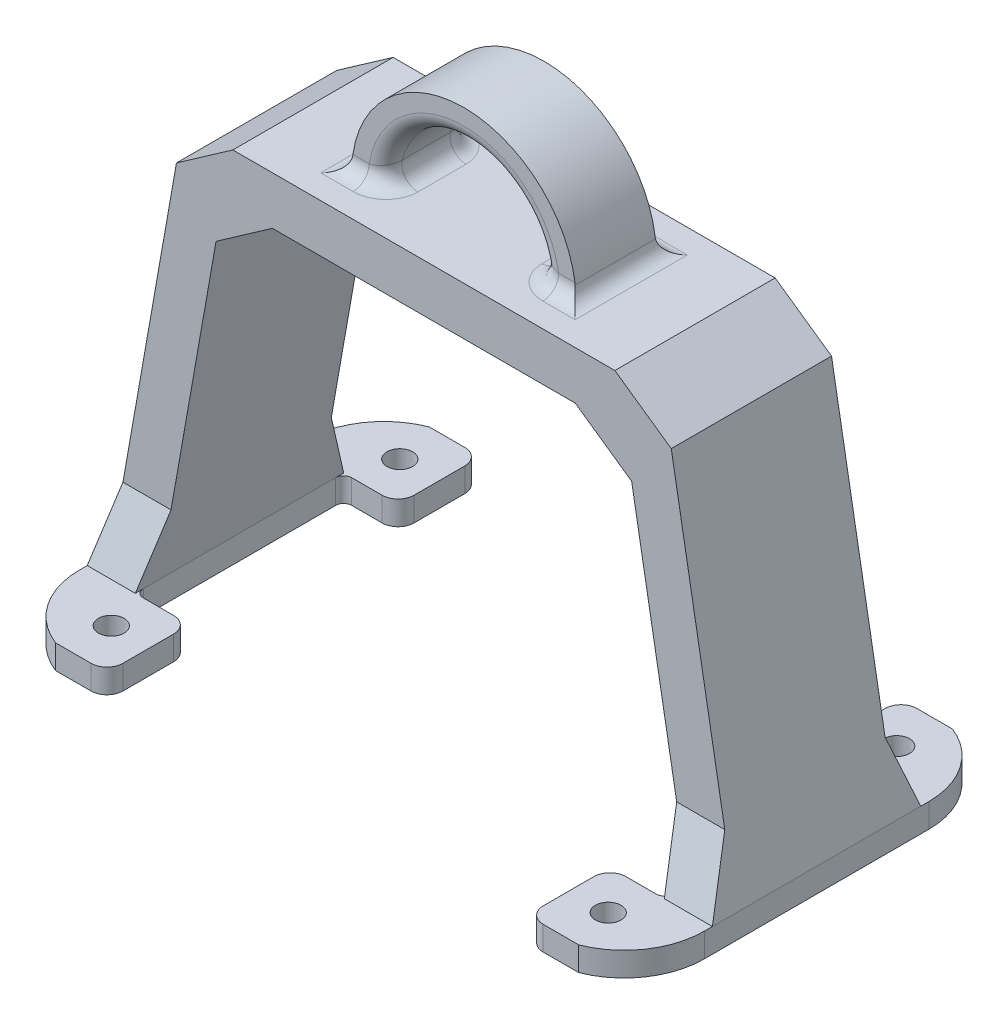
from build123d import *
from OCP.BRepFilletAPI import BRepFilletAPI_MakeChamfer

# Parameters (mm, degrees)
SKETCH1_R                = 1.6
SKETCH1_R_2              = 1.599999999999995
BOSS_EXTRUDE1_DEPTH      = 3
BOSS_EXTRUDE2_DEPTH      = 10
BOSS_EXTRUDE2_DEPTH_BACK = 10
CHAMFER1_SIZE            = 3
CHAMFER1_SIZE_2          = 8.242432258
CHAMFER2_SIZE            = 5
CHAMFER2_SIZE2           = 6.165654700734795
CHAMFER2_SIZE2_2         = 6.165654700734792
FILLET1_R                = 1
FILLET2_R                = 2
BOSS_EXTRUDE3_DEPTH      = 5
BOSS_EXTRUDE3_DEPTH_BACK = 5
FILLET3_R                = 2


with BuildPart() as part:
    # Sketch1 → Boss-Extrude1 (new body)
    with BuildSketch(Plane(origin=(0, 0, 0), x_dir=(1, 0, 0), z_dir=(0, 1, 0))):
        with BuildLine():
            Line((6.421175820560995, -1.9507906118067657), (0, -1.9507906118067657))
            Line((0, -1.9507906118067657), (0, 8.370717643509872))
            Line((0, 8.370717643509872), (6.784812184197089, 8.370717643509872))
            Line((6.784812184197089, 8.370717643509872), (6.784812184197089, 34.370717643510055))
            Line((6.784812184197089, 34.370717643510055), (0, 34.370717643510055))
            Line((0, 34.370717643510055), (0, 44.69222589882669))
            Line((0, 44.69222589882669), (6.421175820560995, 44.69222589882669))
            ThreePointArc((6.421175820560995, 44.69222589882669), (11.042040422644941, 41.01757685976807), (12.78481218419652, 35.37681611159011))
            Line((12.78481218419652, 35.37681611159011), (12.784812184196529, 7.364619175428122))
            ThreePointArc((12.784812184196529, 7.364619175428122), (11.042040422644465, 1.7238584272511508), (6.421175820560995, -1.9507906118067657))
        make_face()
        with Locations(Location((4.7848121841973095, 3.370717643509865, 0), (0, 0, 270))):
            Circle(SKETCH1_R, mode=Mode.SUBTRACT)
        with Locations(Location((4.7848121841973095, 39.37071764350986, 0), (0, 0, 270))):
            Circle(SKETCH1_R_2, mode=Mode.SUBTRACT)
    extrude(amount=BOSS_EXTRUDE1_DEPTH)

    # Sketch2 → Boss-Extrude2 (add, two sides: drawn at the far end of the back side and taken through both)
    with BuildSketch(Plane.XY.offset(-21.370717643509963).offset(-BOSS_EXTRUDE2_DEPTH_BACK)):
        Polygon((12.784812184196529, 3), (4.841459537267648, 48), (3.782345851010469, 54.00000000000001), (-26.217654148989528, 54), (-26.217654148989528, 48), (-1.158540462732349, 48), (6.784812184196529, 3), align=None)
    extrude(amount=BOSS_EXTRUDE2_DEPTH + BOSS_EXTRUDE2_DEPTH_BACK)

    # Chamfer1
    # the kernel refuses this chamfer: 8.242432258, 3 mm, written as the material it adds along each edge
    with BuildSketch(Plane(origin=(-14.597662163855837, 3, -31.370717643509963), x_dir=(0, -0.09904090225205073, -0.9950833631817486), z_dir=(1, 0, 0))) as chamfer1_piece_1_section:
        Polygon((CHAMFER1_SIZE * 0.995083363182, CHAMFER1_SIZE * 0.0990409022521), (-CHAMFER1_SIZE_2 * 0.0990409022564, CHAMFER1_SIZE_2 * 0.995083363226), (0, 0), align=None)
    chamfer1_piece_1 = extrude(amount=27.382474348052366, mode=Mode.PRIVATE)
    chamfer1_piece_1 = split(chamfer1_piece_1, bisect_by=Plane(origin=(6.784812184197089, 7.456039149673087, -31.96998731655782), z_dir=(-1, 0, 0)), keep=Keep.TOP, mode=Mode.PRIVATE)
    chamfer1_piece_1 = split(chamfer1_piece_1, bisect_by=Plane(origin=(6.01012097218014, 7.388714197929481, -31.96998731655782), z_dir=(0.984775407452154, 0.17383151865367846, 0)), keep=Keep.TOP, mode=Mode.PRIVATE)
    add(chamfer1_piece_1)
    with BuildSketch(Plane(origin=(6.784812184196529, 3, -31.370717643509963), x_dir=(0, -0.09904090225205073, -0.9950833631817486), z_dir=(1, 0, 0))) as chamfer1_piece_2_section:
        Polygon((CHAMFER1_SIZE * 0.995083363182, CHAMFER1_SIZE * 0.0990409022521), (-CHAMFER1_SIZE_2 * 0.0990409022564, CHAMFER1_SIZE_2 * 0.995083363226), (0, 0), align=None)
    chamfer1_piece_2 = extrude(amount=6, mode=Mode.PRIVATE)
    chamfer1_piece_2 = split(chamfer1_piece_2, bisect_by=Plane(origin=(9.548273818498073, 5.680033716673279, -34.370717643510055), z_dir=(0, 0, 1)), keep=Keep.TOP, mode=Mode.PRIVATE)
    chamfer1_piece_2 = split(chamfer1_piece_2, bisect_by=Plane(origin=(12.22823083574693, 6.15309690926482, -32.316977679100475), z_dir=(-0.984775407452154, -0.17383151865367855, 0)), keep=Keep.TOP, mode=Mode.PRIVATE)
    chamfer1_piece_2 = split(chamfer1_piece_2, bisect_by=Plane(origin=(6.409535217011595, 5.125986881603595, -32.316977679100475), z_dir=(0.984775407452154, 0.17383151865367846, 0)), keep=Keep.TOP, mode=Mode.PRIVATE)
    add(chamfer1_piece_2)
    with BuildSketch(Plane(origin=(-14.597662163855837, 3, -11.370717643509963), x_dir=(0, -0.09904090225205067, 0.9950833631817486), z_dir=(1, 0, 0))) as chamfer1_piece_3_section:
        Polygon((CHAMFER1_SIZE * 0.995083363182, -CHAMFER1_SIZE * 0.0990409022521), (-CHAMFER1_SIZE_2 * 0.0990409022564, -CHAMFER1_SIZE_2 * 0.995083363226), (0, 0), align=None)
    chamfer1_piece_3 = extrude(amount=27.382474348052366, mode=Mode.PRIVATE)
    chamfer1_piece_3 = split(chamfer1_piece_3, bisect_by=Plane(origin=(6.784812184197089, 7.456039149673425, -10.771447970462173), z_dir=(-1, 0, 0)), keep=Keep.TOP, mode=Mode.PRIVATE)
    chamfer1_piece_3 = split(chamfer1_piece_3, bisect_by=Plane(origin=(6.01012097218008, 7.388714197929815, -10.771447970462173), z_dir=(0.984775407452154, 0.17383151865367846, 0)), keep=Keep.TOP, mode=Mode.PRIVATE)
    add(chamfer1_piece_3)
    with BuildSketch(Plane(origin=(6.784812184196529, 3, -11.370717643509963), x_dir=(0, -0.09904090225205067, 0.9950833631817486), z_dir=(1, 0, 0))) as chamfer1_piece_4_section:
        Polygon((CHAMFER1_SIZE * 0.995083363182, -CHAMFER1_SIZE * 0.0990409022521), (-CHAMFER1_SIZE_2 * 0.0990409022564, -CHAMFER1_SIZE_2 * 0.995083363226), (0, 0), align=None)
    chamfer1_piece_4 = extrude(amount=6, mode=Mode.PRIVATE)
    chamfer1_piece_4 = split(chamfer1_piece_4, bisect_by=Plane(origin=(9.548273818498181, 5.680033716673251, -8.370717643509872), z_dir=(0, 0, -1)), keep=Keep.TOP, mode=Mode.PRIVATE)
    chamfer1_piece_4 = split(chamfer1_piece_4, bisect_by=Plane(origin=(12.228230835746936, 6.153096909264775, -10.424457607919365), z_dir=(-0.984775407452154, -0.17383151865367855, 0)), keep=Keep.TOP, mode=Mode.PRIVATE)
    chamfer1_piece_4 = split(chamfer1_piece_4, bisect_by=Plane(origin=(6.409535217011604, 5.125986881603545, -10.424457607919365), z_dir=(0.984775407452154, 0.17383151865367846, 0)), keep=Keep.TOP, mode=Mode.PRIVATE)
    add(chamfer1_piece_4)

    # Chamfer2: one chamfer whose edges measure the first distance from different faces: ONE call of the kernel's chamfer builder (chamfer() names one face for all edges)
    chamfer2_edges_1 = [part.edges().sort_by_distance(p)[0] for p in [
        (-1.158540462732349, 48, -21.370717643509963),
    ]]
    chamfer2_side_1 = [part.faces().sort_by_distance(p)[0] for p in [
        (2.9063704067151908, 24.97181564812636, -21.370717643509966),
    ]]
    chamfer2_edges_2 = [part.edges().sort_by_distance(p)[0] for p in [
        (3.782345851010469, 54.00000000000001, -21.370717643509963),
    ]]
    chamfer2_side_2 = [part.faces().sort_by_distance(p)[0] for p in [
        (8.378638311255342, 27.961478244160574, -21.37071764351),
    ]]
    chamfer2 = BRepFilletAPI_MakeChamfer(part.part.solid().wrapped)
    for e in chamfer2_edges_1:
        chamfer2.Add(CHAMFER2_SIZE, CHAMFER2_SIZE2, e.wrapped, chamfer2_side_1[0].wrapped)  # the first distance lies on this face
    for e in chamfer2_edges_2:
        chamfer2.Add(CHAMFER2_SIZE, CHAMFER2_SIZE2_2, e.wrapped, chamfer2_side_2[0].wrapped)  # the first distance lies on this face
    add(Compound.cast(chamfer2.Shape()), mode=Mode.REPLACE)

    # Mirror1: part across plane


with BuildPart() as part_1:
    add(part.part)
    add(part.part.mirror(Plane(origin=(-26.217654148989528, 54, -31.37071764350996), x_dir=(0, 0, 1), z_dir=(-1, 0, 0))))

    # Fillet1
    # the kernel refuses this fillet: 1 mm, written as the material it adds along each edge
    with BuildSketch(Plane(origin=(-59.22012048217614, 0, -34.370717643510055), x_dir=(1, 0, 0), z_dir=(0, 1, 0))) as fillet1_piece_1:
        with BuildLine():
            CenterArc((FILLET1_R, -FILLET1_R), FILLET1_R, 90, 90)
            Line((0, -FILLET1_R), (0, 0))
            Line((0, 0), (FILLET1_R, 0))
        make_face()
    extrude(amount=3)
    with BuildSketch(Plane(origin=(-59.22012048217614, 0, -8.370717643509872), x_dir=(1, 0, 0), z_dir=(0, 1, 0))) as fillet1_piece_2:
        with BuildLine():
            CenterArc((FILLET1_R, FILLET1_R), FILLET1_R, 180, 90)
            Line((0, FILLET1_R), (0, 0))
            Line((0, 0), (FILLET1_R, 0))
        make_face()
    extrude(amount=3)
    with BuildSketch(Plane(origin=(6.784812184197089, 0, -8.370717643509872), x_dir=(0, 0, -1), z_dir=(0, 1, 0))) as fillet1_piece_3:
        with BuildLine():
            CenterArc((FILLET1_R, FILLET1_R), FILLET1_R, 180, 90)
            Line((0, FILLET1_R), (0, 0))
            Line((0, 0), (FILLET1_R, 0))
        make_face()
    extrude(amount=3)
    with BuildSketch(Plane(origin=(6.784812184197089, 0, -34.370717643510055), x_dir=(0, 0, 1), z_dir=(0, 1, 0))) as fillet1_piece_4:
        with BuildLine():
            CenterArc((FILLET1_R, -FILLET1_R), FILLET1_R, 90, 90)
            Line((0, -FILLET1_R), (0, 0))
            Line((0, 0), (FILLET1_R, 0))
        make_face()
    extrude(amount=3)

    # Fillet2
    fillet2_edges = [part_1.edges().sort_by_distance(p)[0] for p in [
        (-52.435308297979056, 1.5, -44.69222589882669),
        (-52.435308297979056, 1.5, -34.370717643510055),
        (-52.435308297979056, 1.5, -8.370717643509872),
        (-52.435308297979056, 1.5, 1.9507906118067657),
        (0, 1.5, 1.9507906118067657),
        (0, 1.5, -8.370717643509872),
        (0, 1.5, -34.370717643510055),
        (0, 1.5, -44.69222589882669),
    ]]
    fillet(fillet2_edges, radius=FILLET2_R)

    # Sketch3 → Boss-Extrude3 (add, two sides: drawn at the far end of the back side and taken through both)
    with BuildSketch(Plane.XY.offset(-21.370717643509963).offset(-BOSS_EXTRUDE3_DEPTH_BACK)):
        with BuildLine():
            Line((-40.21765414898952, 54.00000000000001), (-36.21765414898952, 54.00000000000001))
            ThreePointArc((-36.21765414898952, 54.00000000000001), (-26.21765414898953, 64), (-16.21765414898953, 54.000000000000014))
            Line((-16.21765414898953, 54.000000000000014), (-12.217654148989538, 54.000000000000014))
            ThreePointArc((-12.217654148989538, 54.000000000000014), (-26.21765414898953, 68), (-40.21765414898952, 54.00000000000001))
        make_face()
    extrude(amount=BOSS_EXTRUDE3_DEPTH + BOSS_EXTRUDE3_DEPTH_BACK)

    # Fillet3
    fillet3_edges = [part_1.edges().sort_by_distance(p)[0] for p in [
        (-16.21765414898953, 54.000000000000014, -21.370717643509963),
        (-26.217654148989528, 64, -26.370717643509963),
        (-36.21765414898952, 54.00000000000001, -21.370717643509963),
        (-38.21765414898952, 54.00000000000001, -26.370717643509963),
        (-40.217654148989524, 54.00000000000001, -21.370717643509963),
        (-12.217654148989538, 54.000000000000014, -21.370717643509963),
        (-14.217654148989535, 54.000000000000014, -26.370717643509963),
        (-26.217654148989528, 64, -16.370717643509963),
        (-14.217654148989535, 54.000000000000014, -16.370717643509963),
        (-38.21765414898952, 54.00000000000001, -16.370717643509963),
    ]]
    fillet(fillet3_edges, radius=FILLET3_R)


solid = part_1.part
